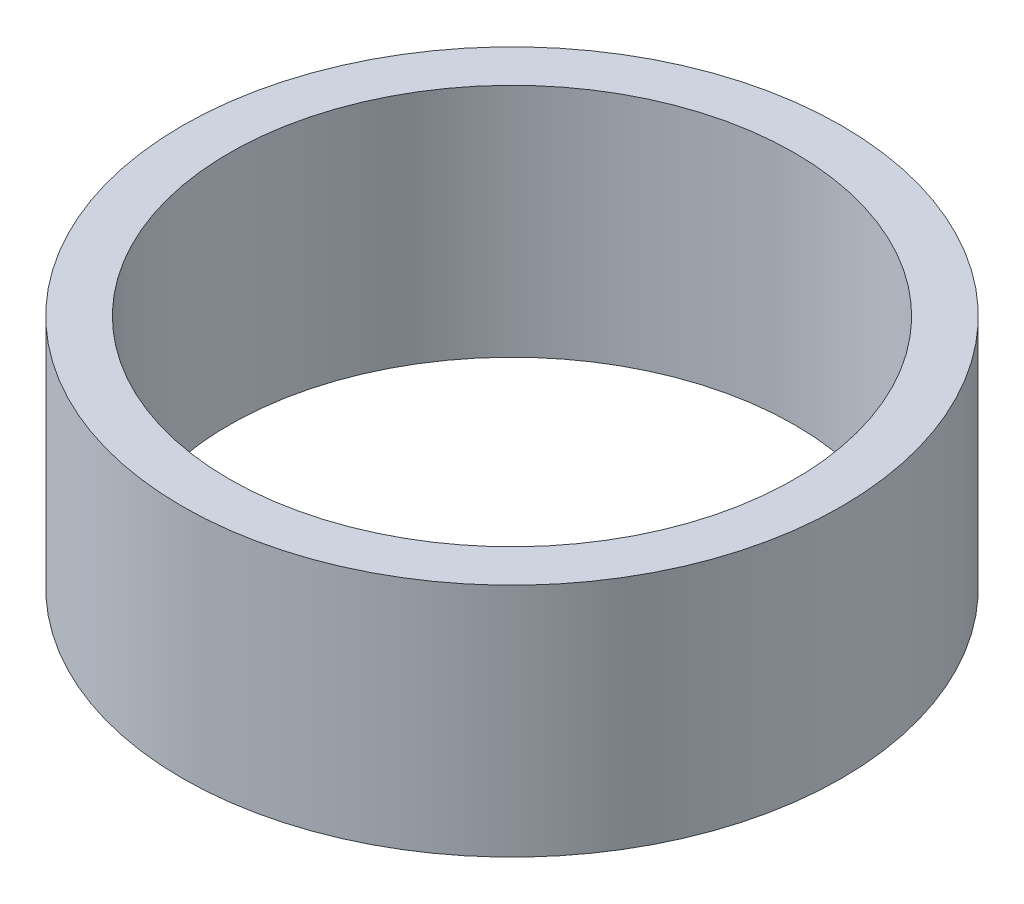
from build123d import *

# Parameters (mm, degrees)
SKETCH1_R           = 7
SKETCH1_R_2         = 6
EXTRUDE_THIN1_DEPTH = 5


with BuildPart() as part:
    # Sketch1 → Extrude-Thin1 (new body)
    with BuildSketch(Plane(origin=(0, 0, 0), x_dir=(1, 0, 0), z_dir=(0, 1, 0))):
        Circle(SKETCH1_R)
        Circle(SKETCH1_R_2, mode=Mode.SUBTRACT)
    extrude(amount=EXTRUDE_THIN1_DEPTH)


solid = part.part
